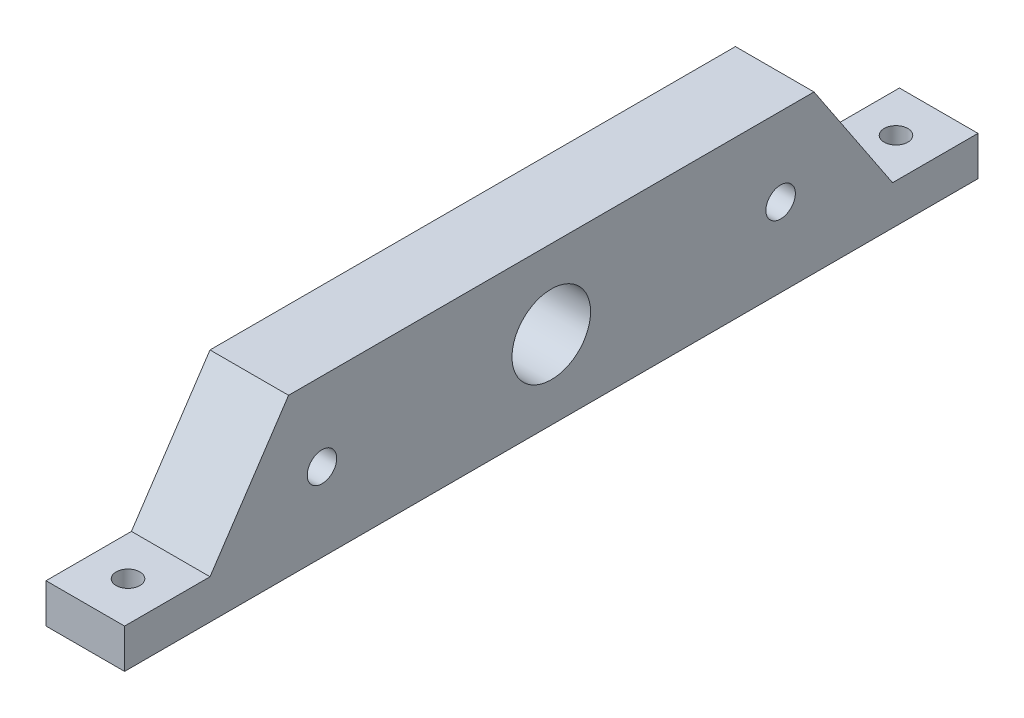
from build123d import *

# Parameters (mm, degrees)
SKETCH2_R               = 3.75
SKETCH2_R_2             = 10
BOSS_EXTRUDE2_DEPTH     = 20
CUT_EXTRUDE1_DEPTH      = 100
CUT_EXTRUDE2_DEPTH      = 301.779846116
CUT_EXTRUDE2_DEPTH_BACK = 301.779846116
SKETCH5_R               = 3.023423491


with BuildPart() as part:
    # Sketch2 → Boss-Extrude2 (new body)
    with BuildSketch(Plane(origin=(0, 0, 0), x_dir=(0, 0, -1), z_dir=(1, 0, 0))):
        Polygon((0, 40), (0, 0), (190, 0), (275.000484829, 0), (380, 0), (380, 40), align=None)
        with Locations((131.63, 20)):
            Circle(SKETCH2_R, mode=Mode.SUBTRACT)
        with Locations((190, 20)):
            Circle(SKETCH2_R_2, mode=Mode.SUBTRACT)
        with Locations((248.37, 20)):
            Circle(SKETCH2_R, mode=Mode.SUBTRACT)
    extrude(amount=BOSS_EXTRUDE2_DEPTH)

    # Sketch4 → Cut-Extrude1 (cut)
    with BuildSketch(Plane(origin=(20, 0, 0), x_dir=(0, 0, -1), z_dir=(1, 0, 0))):
        Polygon((103.1360247, 10), (123.129236316, 40), (0, 40), (0, 0), (81.389022591, 0), (81.389022591, 10), align=None)
        Polygon((380, 40), (256.870763684, 40), (276.8639753, 10), (298.610977409, 10), (298.610977409, 0), (380, 0), align=None)
    extrude(amount=-CUT_EXTRUDE1_DEPTH, mode=Mode.SUBTRACT)

    # Sketch5 → Cut-Extrude2 (cut, two sides: drawn at the far end of the back side and taken through both)
    with BuildSketch(Plane(origin=(0, 10, 0), x_dir=(1, 0, 0), z_dir=(0, 1, 0)).offset(-CUT_EXTRUDE2_DEPTH_BACK)):
        with Locations((10, 92.262523645)):
            Circle(SKETCH5_R)
        with Locations((10, 287.737476355)):
            Circle(SKETCH5_R)
    extrude(amount=CUT_EXTRUDE2_DEPTH + CUT_EXTRUDE2_DEPTH_BACK, mode=Mode.SUBTRACT)


solid = part.part
